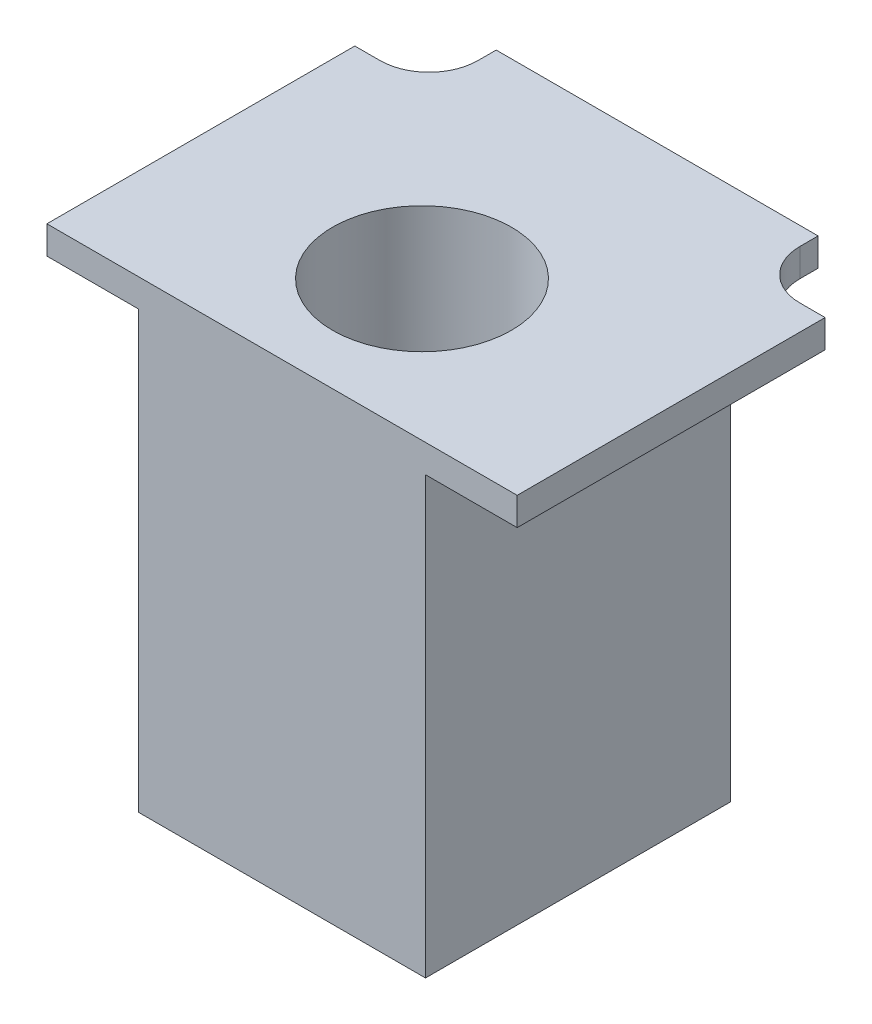
from build123d import *

# Parameters (mm, degrees)
SKETCH1_W           = 10.25
SKETCH1_H           = 10.9
BOSS_EXTRUDE1_DEPTH = 1.5
SKETCH2_W           = 6.39
SKETCH2_H           = 8.4
CUT_EXTRUDE1_DEPTH  = 8.630080275
SKETCH3_W           = 10.25
SKETCH3_H           = 10.9
SKETCH3_R           = 3.195
BOSS_EXTRUDE2_DEPTH = 15.07
BOSS_EXTRUDE3_DEPTH = 1


with BuildPart() as part:
    # Sketch1 → Boss-Extrude1 (new body)
    with BuildSketch(Plane(origin=(0, 0, 0), x_dir=(1, 0, 0), z_dir=(0, 1, 0))):
        Rectangle(SKETCH1_W, SKETCH1_H)
    extrude(amount=BOSS_EXTRUDE1_DEPTH)

    # Sketch2 → Cut-Extrude1 (cut, through all)
    with BuildSketch(Plane(origin=(0, 1.5, 0), x_dir=(1, 0, 0), z_dir=(0, 1, 0))):
        with Locations((0, -0.45)):
            Rectangle(SKETCH2_W, SKETCH2_H)
    extrude(amount=-CUT_EXTRUDE1_DEPTH, mode=Mode.SUBTRACT)

    # Sketch3 → Boss-Extrude2 (add)
    with BuildSketch(Plane(origin=(0, 1.5, 0), x_dir=(1, 0, 0), z_dir=(0, 1, 0))):
        Rectangle(SKETCH3_W, SKETCH3_H)
        with Locations((0, -0.45)):
            Circle(SKETCH3_R, mode=Mode.SUBTRACT)
    extrude(amount=BOSS_EXTRUDE2_DEPTH)

    # Sketch5 → Boss-Extrude3 (add)
    with BuildSketch(Plane(origin=(0, 16.57, 0), x_dir=(1, 0, 0), z_dir=(0, 1, 0))):
        with BuildLine():
            Line((-5.75, 7.95), (-5.75, 7.3))
            ThreePointArc((-5.75, 7.3), (-6.262563133, 6.062563133), (-7.5, 5.55))
            Line((-7.5, 5.55), (-8.4, 5.55))
            Line((-8.4, 5.55), (-8.4, -5.45))
            Line((-8.4, -5.45), (-5.125, -5.45))
            Line((-5.125, -5.45), (-5.125, 5.45))
            Line((-5.125, 5.45), (5.125, 5.45))
            Line((5.125, 5.45), (5.125, -5.45))
            Line((5.125, -5.45), (8.4, -5.45))
            Line((8.4, -5.45), (8.4, 5.55))
            Line((8.4, 5.55), (7.5, 5.55))
            ThreePointArc((7.5, 5.55), (6.262563133, 6.062563133), (5.75, 7.3))
            Line((5.75, 7.3), (5.75, 7.95))
            Line((5.75, 7.95), (-5.75, 7.95))
        make_face()
    extrude(amount=-BOSS_EXTRUDE3_DEPTH)


solid = part.part
